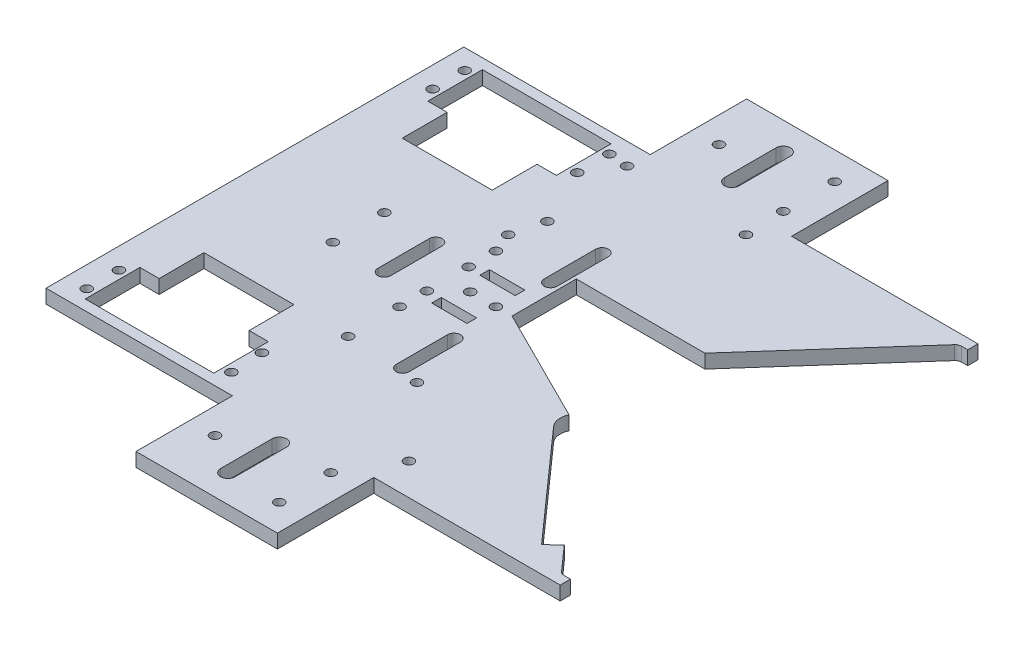
from build123d import *

# Parameters (mm, degrees)
BOSS_EXTRUDE1_DEPTH = 4.3
CUT_EXTRUDE1_DEPTH  = 4.5
FILLET1_R           = 2
CUT_EXTRUDE2_DEPTH  = 10
SKETCH8_R           = 1.5
CUT_EXTRUDE3_DEPTH  = 10
SKETCH9_R           = 1.5
CUT_EXTRUDE4_DEPTH  = 10
CUT_EXTRUDE5_DEPTH  = 10
SKETCH11_R          = 1.5
CUT_EXTRUDE6_DEPTH  = 10
SKETCH12_R          = 1.5
CUT_EXTRUDE7_DEPTH  = 10
SKETCH7_R           = 1.5
SKETCH7_W           = 11
SKETCH7_H           = 3
CUT_EXTRUDE8_DEPTH  = 9
SKETCH13_R          = 1.5
CUT_EXTRUDE9_DEPTH  = 10
SKETCH14_R          = 1.5
CUT_EXTRUDE10_DEPTH = 10


with BuildPart() as part:
    # Sketch2 → Boss-Extrude1 (new body)
    with BuildSketch(Plane(origin=(0, 0, 0), x_dir=(1, 0, 0), z_dir=(0, 1, 0))):
        Polygon((0, 0), (0, 65), (58, 65), (58, 95), (102, 95), (102, 65), (160, 65), (160, 0), align=None)
    extrude(amount=BOSS_EXTRUDE1_DEPTH)

    # Mirror1: part across plane


with BuildPart() as part_1:
    add(part.part)
    add(part.part.mirror(Plane(origin=(0, 4.3, 0), x_dir=(1, 0, 0), z_dir=(0, 0, -1))))

    # Sketch3 → Cut-Extrude1 (cut)
    with BuildSketch(Plane(origin=(0, 4.3, 0), x_dir=(1, 0, 0), z_dir=(0, 1, 0))):
        Polygon((160, -61.8), (160, 61.8), (157.156451185, 61.8), (120.012594795, 20), (80.012594795, 20), (80.012594795, 0), (120, -20), (157.155555556, -61.8), align=None)
    extrude(amount=-CUT_EXTRUDE1_DEPTH, mode=Mode.SUBTRACT)

    # Fillet1
    fillet1_edges = [part_1.edges().sort_by_distance(p)[0] for p in [
        (157.156451185, 2.15, -61.8),
        (157.155555556, 2.15, 61.8),
    ]]
    fillet(fillet1_edges, radius=FILLET1_R)

    # Sketch6 → Cut-Extrude2 (cut)
    with BuildSketch(Plane(origin=(0, 4.3, 0), x_dir=(1, 0, 0), z_dir=(0, 1, 0))):
        Polygon((9, -61.8), (49, -61.8), (49, -44.8), (43, -44.8), (43, -30.841820122), (15, -30.841820122), (15, -44.8), (9, -44.8), align=None)
        Polygon((9, 44.8), (15, 44.8), (15, 30.841820122), (43, 30.841820122), (43, 44.8), (49, 44.8), (49, 61.8), (9, 61.8), align=None)
    extrude(amount=-CUT_EXTRUDE2_DEPTH, mode=Mode.SUBTRACT)

    # Sketch8 → Cut-Extrude3 (cut)
    with BuildSketch(Plane(origin=(0, 4.3, 0), x_dir=(1, 0, 0), z_dir=(0, 1, 0))):
        with Locations((6.5, 58.8)):
            Circle(SKETCH8_R)
        with Locations((6.5, 48.8)):
            Circle(SKETCH8_R)
        with Locations((51.5, 48.8)):
            Circle(SKETCH8_R)
        with Locations((51.5, 58.8)):
            Circle(SKETCH8_R)
        with Locations((6.5, -48.8)):
            Circle(SKETCH8_R)
        with Locations((6.5, -58.8)):
            Circle(SKETCH8_R)
        with Locations((51.5, -58.8)):
            Circle(SKETCH8_R)
        with Locations((51, -48.8)):
            Circle(SKETCH8_R)
    extrude(amount=-CUT_EXTRUDE3_DEPTH, mode=Mode.SUBTRACT)

    # Sketch9 → Cut-Extrude4 (cut)
    with BuildSketch(Plane.XZ):
        with Locations((94, 70.4)):
            Circle(SKETCH9_R)
        with Locations((66, 78.4)):
            Circle(SKETCH9_R)
        with Locations((66, -78.4)):
            Circle(SKETCH9_R)
        with Locations((94, -86.4)):
            Circle(SKETCH9_R)
        with Locations((94, 86.4)):
            Circle(SKETCH9_R)
        with Locations((94, -70.4)):
            Circle(SKETCH9_R)
        with BuildLine():
            Line((75.75, 70.4), (75.75, 86.4))
            ThreePointArc((75.75, 86.4), (78, 88.65), (80.25, 86.4))
            Line((80.25, 86.4), (80.25, 70.4))
            ThreePointArc((80.25, 70.4), (78, 68.15), (75.75, 70.4))
        make_face()
        with BuildLine():
            Line((75.75, -86.4), (75.75, -70.4))
            ThreePointArc((75.75, -70.4), (78, -68.15), (80.25, -70.4))
            Line((80.25, -70.4), (80.25, -86.4))
            ThreePointArc((80.25, -86.4), (78, -88.65), (75.75, -86.4))
        make_face()
    extrude(amount=-CUT_EXTRUDE4_DEPTH, mode=Mode.SUBTRACT)

    # Sketch10 → Cut-Extrude5 (cut)
    with BuildSketch(Plane(origin=(0, 4.3, 0), x_dir=(1, 0, 0), z_dir=(0, 1, 0))):
        with BuildLine():
            Line((123.321819194, -23.737046593), (149.896372747, -53.633419341))
            Line((149.896372747, -53.633419341), (146.159326154, -56.955238535))
            Line((146.159326154, -56.955238535), (116.262953407, -23.321819194))
            ThreePointArc((116.262953407, -23.321819194), (120.29361011, -15.008628134), (123.321819194, -23.737046593))
        make_face()
    extrude(amount=-CUT_EXTRUDE5_DEPTH, mode=Mode.SUBTRACT)

    # Sketch11 → Cut-Extrude6 (cut)
    with BuildSketch(Plane.XZ):
        with BuildLine():
            ThreePointArc((79, 31.031280577), (77, 33.031280577), (75, 31.031280577))
            Line((75, 31.031280577), (75, 15.031280577))
            ThreePointArc((75, 15.031280577), (77, 13.031280577), (79, 15.031280577))
            Line((79, 15.031280577), (79, 31.031280577))
        make_face()
        with BuildLine():
            ThreePointArc((75, -31.031280577), (77, -33.031280577), (79, -31.031280577))
            Line((79, -31.031280577), (79, -15.031280577))
            ThreePointArc((79, -15.031280577), (77, -13.031280577), (75, -15.031280577))
            Line((75, -15.031280577), (75, -31.031280577))
        make_face()
        with Locations((60, 31)):
            Circle(SKETCH11_R)
        with Locations((60, 15)):
            Circle(SKETCH11_R)
        with Locations((60, -15)):
            Circle(SKETCH11_R)
        with Locations((60, -31)):
            Circle(SKETCH11_R)
    extrude(amount=-CUT_EXTRUDE6_DEPTH, mode=Mode.SUBTRACT)

    # Sketch12 → Cut-Extrude7 (cut)
    with BuildSketch(Plane(origin=(0, 0, 0), x_dir=(-1, 0, 0), z_dir=(0, -1, 0))):
        with BuildLine():
            ThreePointArc((-50.262723036, -8), (-48.262723036, -10), (-46.262723036, -8))
            Line((-46.262723036, -8), (-46.262723036, 8))
            ThreePointArc((-46.262723036, 8), (-48.262723036, 10), (-50.262723036, 8))
            Line((-50.262723036, 8), (-50.262723036, -8))
        make_face()
        with Locations((-32.262723036, -8)):
            Circle(SKETCH12_R)
        with Locations((-32.262723036, 8)):
            Circle(SKETCH12_R)
    extrude(amount=-CUT_EXTRUDE7_DEPTH, mode=Mode.SUBTRACT)

    # Sketch7 → Cut-Extrude8 (cut)
    with BuildSketch(Plane(origin=(0, 4.3, 0), x_dir=(1, 0, 0), z_dir=(0, 1, 0))):
        with Locations((60.012594795, -6.5)):
            Circle(SKETCH7_R)
        with Locations((60.012594795, 6.5)):
            Circle(SKETCH7_R)
        with Locations((69.5, -7.5)):
            Rectangle(SKETCH7_W, SKETCH7_H)
        with Locations((69.5, 7.5)):
            Rectangle(SKETCH7_W, SKETCH7_H)
    extrude(amount=-CUT_EXTRUDE8_DEPTH, mode=Mode.SUBTRACT)

    # Sketch13 → Cut-Extrude9 (cut)
    with BuildSketch(Plane(origin=(0, 4.3, 0), x_dir=(1, 0, 0), z_dir=(0, 1, 0))):
        with Locations((75, 0)):
            Circle(SKETCH13_R)
        with Locations((67, 0)):
            Circle(SKETCH13_R)
    extrude(amount=-CUT_EXTRUDE9_DEPTH, mode=Mode.SUBTRACT)

    # Sketch14 → Cut-Extrude10 (cut)
    with BuildSketch(Plane(origin=(0, 4.3, 0), x_dir=(1, 0, 0), z_dir=(0, 1, 0))):
        with Locations((57.5, 58.3)):
            Circle(SKETCH14_R)
        with Locations((94.5, 58.3)):
            Circle(SKETCH14_R)
        with Locations((57.5, 21.3)):
            Circle(SKETCH14_R)
        with Locations((83.127806945, -32.705958418)):
            Circle(SKETCH14_R)
        with Locations((103.05872211, -55.128237978)):
            Circle(SKETCH14_R)
    extrude(amount=-CUT_EXTRUDE10_DEPTH, mode=Mode.SUBTRACT)


solid = part_1.part
